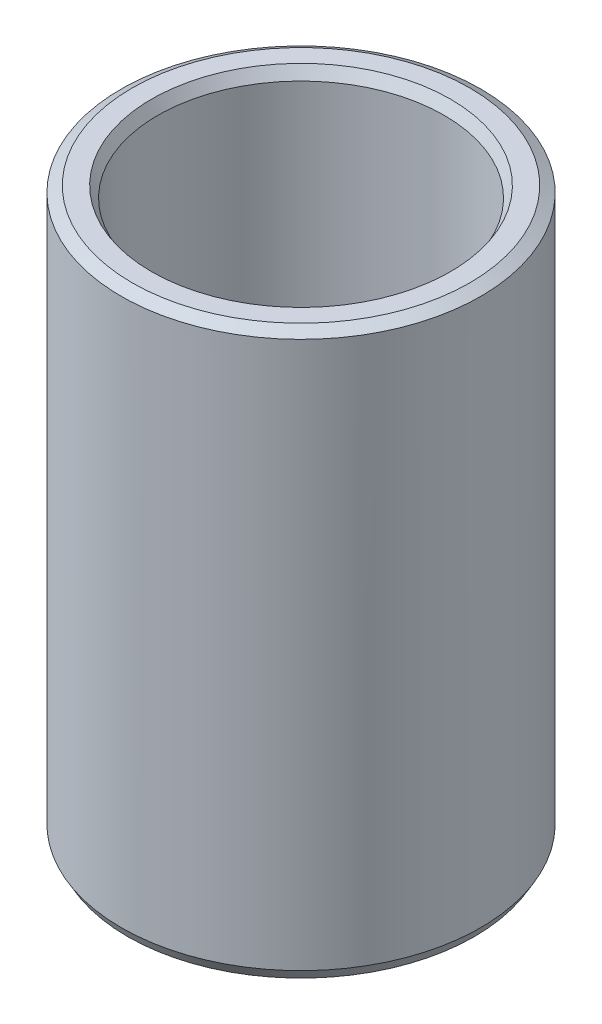
from build123d import *
from OCP.BRepFilletAPI import BRepFilletAPI_MakeChamfer

# Parameters (mm, degrees)
SKETCH1_R           = 25
BOSS_EXTRUDE1_DEPTH = 78.450364947
SKETCH2_R           = 19.922371724
CUT_EXTRUDE1_DEPTH  = 87.049170596
CHAMFER1_SIZE       = 0.874976233
CHAMFER1_SIZE2      = 1.515503292


with BuildPart() as part:
    # Sketch1 → Boss-Extrude1 (new body)
    with BuildSketch(Plane(origin=(0, 0, 0), x_dir=(1, 0, 0), z_dir=(0, 1, 0))):
        Circle(SKETCH1_R)
    extrude(amount=BOSS_EXTRUDE1_DEPTH)

    # Sketch2 → Cut-Extrude1 (cut, through all)
    with BuildSketch(Plane(origin=(0, 0, 0), x_dir=(1, 0, 0), z_dir=(0, 1, 0))):
        Circle(SKETCH2_R)
    extrude(amount=CUT_EXTRUDE1_DEPTH, mode=Mode.SUBTRACT)

    # Chamfer1: one chamfer whose edges measure the first distance from different faces: ONE call of the kernel's chamfer builder (chamfer() names one face for all edges)
    chamfer1_edges_1 = [part.edges().sort_by_distance(p)[0] for p in [
        (-19.922371724, 78.450364947, 0),
    ]]
    chamfer1_side_1 = [part.faces().sort_by_distance(p)[0] for p in [
        (-24.292893219, 78.450364947, 0),
    ]]
    chamfer1_edges_2 = [part.edges().sort_by_distance(p)[0] for p in [
        (-19.922371724, 0, 0),
    ]]
    chamfer1_side_2 = [part.faces().sort_by_distance(p)[0] for p in [
        (-19.922371724, 39.225182473, 0),
    ]]
    chamfer1_edges_3 = [part.edges().sort_by_distance(p)[0] for p in [
        (-25, 0, 0),
    ]]
    chamfer1_side_3 = [part.faces().sort_by_distance(p)[0] for p in [
        (-24.292893219, 0, 0),
    ]]
    chamfer1_edges_4 = [part.edges().sort_by_distance(p)[0] for p in [
        (-25, 78.450364947, 0),
    ]]
    chamfer1_side_4 = [part.faces().sort_by_distance(p)[0] for p in [
        (-25, 39.225182473, 0),
    ]]
    chamfer1 = BRepFilletAPI_MakeChamfer(part.part.solid().wrapped)
    for e in chamfer1_edges_1:
        chamfer1.Add(CHAMFER1_SIZE, CHAMFER1_SIZE2, e.wrapped, chamfer1_side_1[0].wrapped)  # the first distance lies on this face
    for e in chamfer1_edges_2:
        chamfer1.Add(CHAMFER1_SIZE, CHAMFER1_SIZE2, e.wrapped, chamfer1_side_2[0].wrapped)  # the first distance lies on this face
    for e in chamfer1_edges_3:
        chamfer1.Add(CHAMFER1_SIZE, CHAMFER1_SIZE2, e.wrapped, chamfer1_side_3[0].wrapped)  # the first distance lies on this face
    for e in chamfer1_edges_4:
        chamfer1.Add(CHAMFER1_SIZE, CHAMFER1_SIZE2, e.wrapped, chamfer1_side_4[0].wrapped)  # the first distance lies on this face
    add(Compound.cast(chamfer1.Shape()), mode=Mode.REPLACE)


solid = part.part
